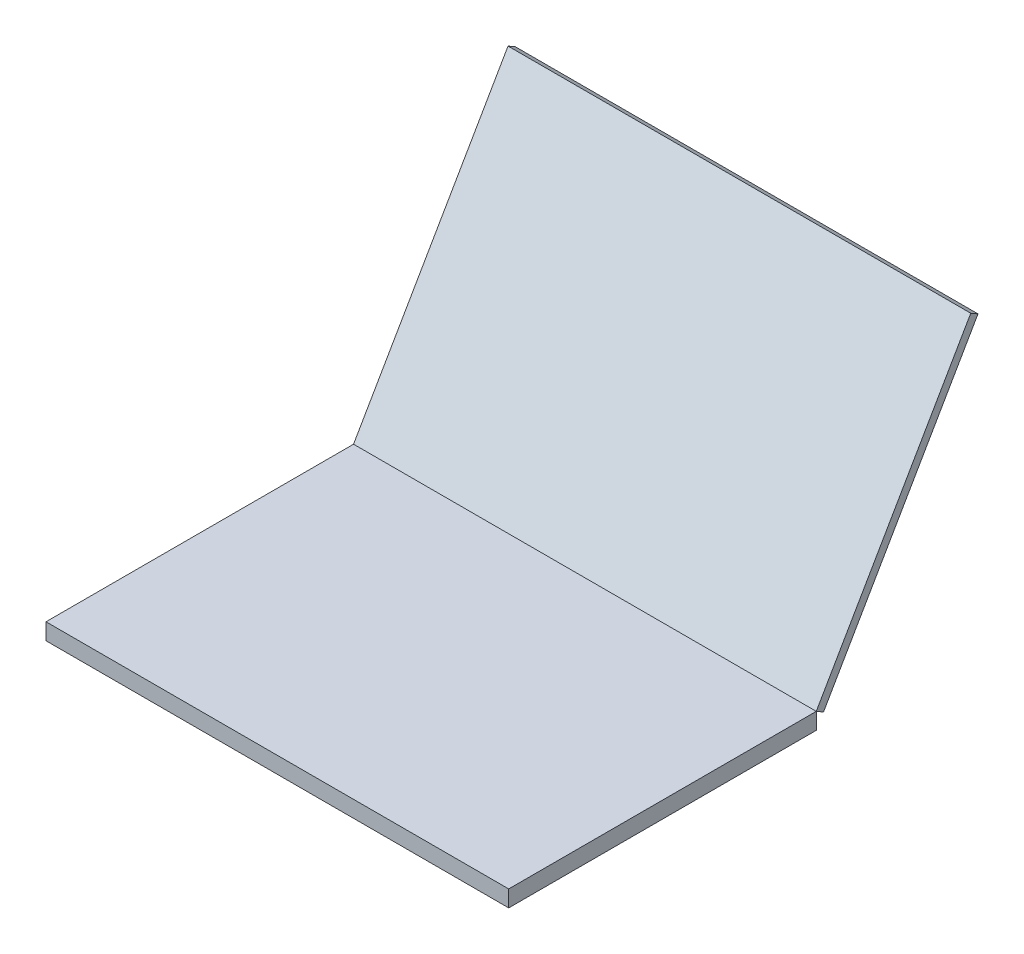
from build123d import *

# Parameters (mm, degrees)
SKETCH1_W             = 331
SKETCH1_H             = 220
BOSS_EXTRUDE1_DEPTH   = 11.78
SKETCH2_W             = 331
SKETCH2_H             = 221
BOSS_EXTRUDE2_DEPTH   = 6
BODY_MOVE_COPY2_ANGLE = 30


with BuildPart() as part:
    # Sketch1 → Boss-Extrude1 (new body)
    with BuildSketch(Plane(origin=(0, 0, 0), x_dir=(1, 0, 0), z_dir=(0, 1, 0))):
        Rectangle(SKETCH1_W, SKETCH1_H)
    extrude(amount=BOSS_EXTRUDE1_DEPTH)


with BuildPart() as body_2:
    # Sketch2 → Boss-Extrude2 (new body)
    with BuildSketch(Plane.XY):
        Rectangle(SKETCH2_W, SKETCH2_H)
    extrude(amount=BOSS_EXTRUDE2_DEPTH)


with BuildPart() as body_2_1:
    # Body-Move/Copy2: read off the stored shape, not the designer's step
    # Body-Move/Copy2: moved
    add(body_2.part.moved(Location((0, 175.7017793, -95.3727944))).rotate(Axis((0, 0, 0), (-1, 0, 0)), BODY_MOVE_COPY2_ANGLE))


solid = Compound([part.part, body_2_1.part])
